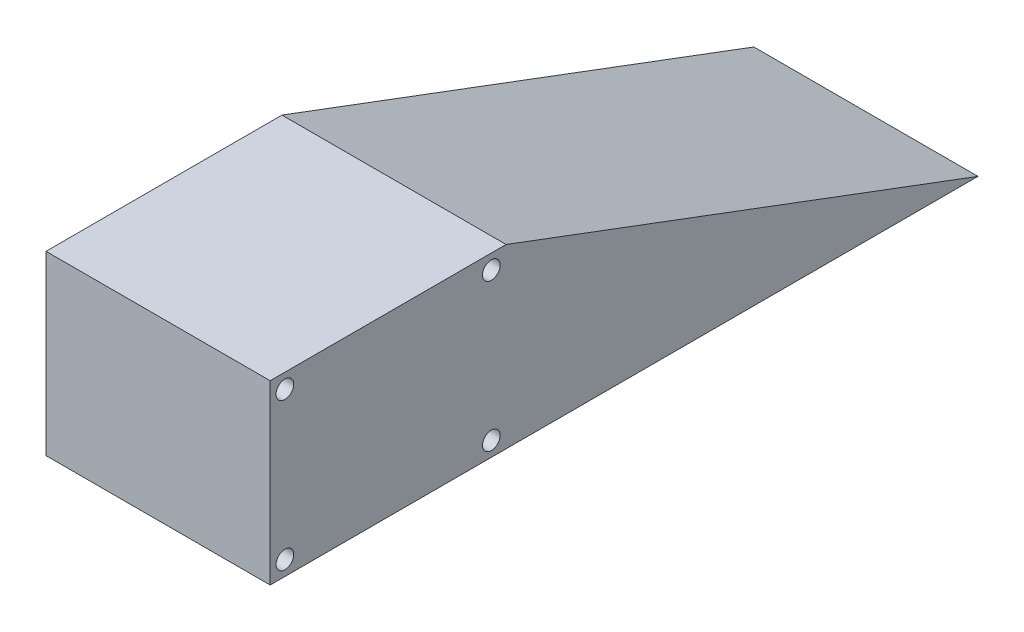
from build123d import *

# Parameters (mm, degrees)
BOSS_EXTRUDE1_DEPTH                = 38
F_3_0_3_DIAMETER_HOLE1_D           = 3
F_3_0_3_DIAMETER_HOLE1_CSINK_D     = 3.05
F_3_0_3_DIAMETER_HOLE1_CSINK_ANGLE = 90


with BuildPart() as part:
    # Sketch1 → Boss-Extrude1 (new body)
    with BuildSketch(Plane(origin=(0, 0, 0), x_dir=(0, 0, -1), z_dir=(1, 0, 0))):
        Polygon((-20, 15), (20, 15), (100, -15), (20, -15), (-20, -15), align=None)
    extrude(amount=BOSS_EXTRUDE1_DEPTH)

    # Ø3.0 (3) Diameter Hole1 (through all)
    with Locations(Plane.ZY):
        with Locations((17.5, 12.5), (-17.5, 12.5), (-17.5, -12.5), (17.5, -12.5)):
            CounterSinkHole(F_3_0_3_DIAMETER_HOLE1_D / 2, F_3_0_3_DIAMETER_HOLE1_CSINK_D / 2, counter_sink_angle=F_3_0_3_DIAMETER_HOLE1_CSINK_ANGLE)


solid = part.part
